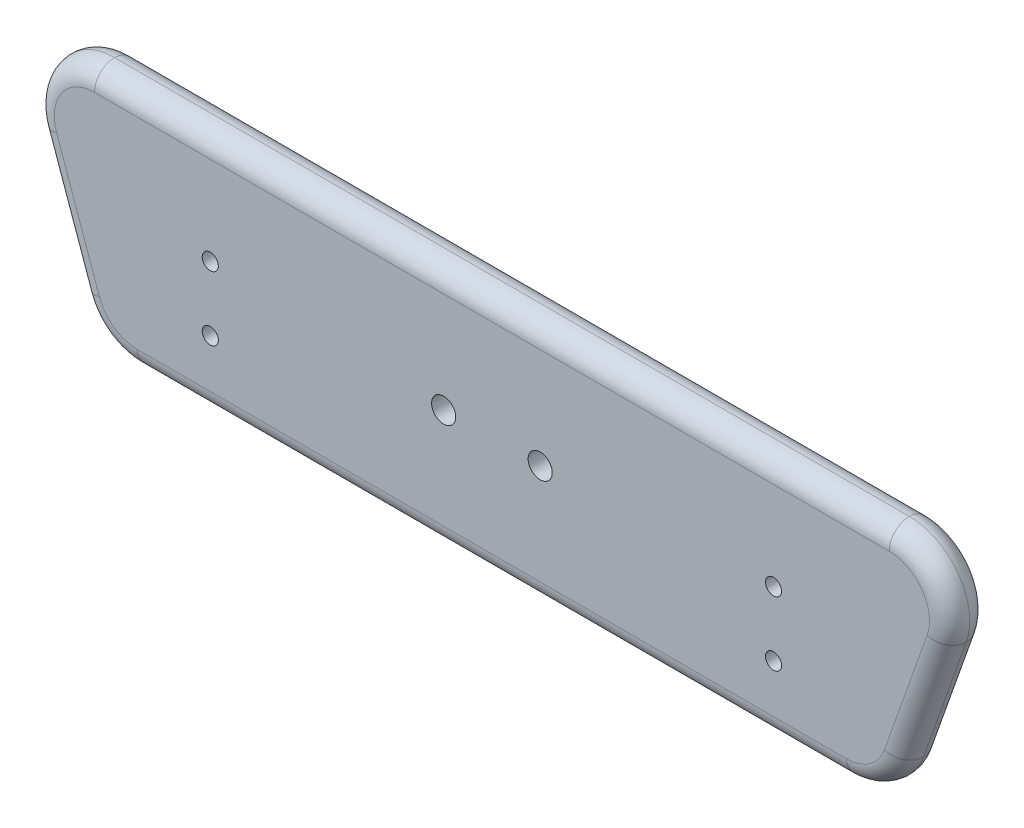
from build123d import *

# Parameters (mm, degrees)
EXTRUDE_1_DEPTH     = 10
FILLET_1_R          = 15
FILLET_2_R          = 5
SKETCH_2_R          = 2
CUT_EXTRUDE_1_DEPTH = 7.5
SKETCH_3_W          = 46
SKETCH_3_H          = 40
CUT_EXTRUDE_2_DEPTH = 4
SKETCH_8_R          = 3
CUT_EXTRUDE_3_DEPTH = 131.716858695


with BuildPart() as part:
    # 草圖1 → 填料-伸長1 (new body)
    with BuildSketch(Plane.XY):
        Polygon((-123.946188341, 3.497757848), (-102.699073989, -56.502242152), (94.806697307, -56.502242152), (116.053811659, 3.497757848), align=None)
    extrude(amount=EXTRUDE_1_DEPTH)

    # 圓角1
    fillet_1_edges = [part.edges().sort_by_distance(p)[0] for p in [
        (116.053811659, 3.497757848, 5),
        (94.806697307, -56.502242152, 5),
        (-102.699073989, -56.502242152, 5),
        (-123.946188341, 3.497757848, 5),
    ]]
    fillet(fillet_1_edges, radius=FILLET_1_R)

    # 圓角2
    fillet_2_edges = [part.edges().sort_by_distance(p)[0] for p in [
        (107.078925905, -2.845064302, 10),
        (103.657146356, -31.509345041, 10),
        (92.862923252, -53.75186548, 10),
        (-3.946188341, -56.502242152, 10),
        (-100.755299934, -53.75186548, 10),
        (-111.549523037, -31.509345041, 10),
        (-114.971302586, -2.845064302, 10),
        (-3.946188341, 3.497757848, 10),
        (-114.971302586, -2.845064302, 0),
        (-111.549523037, -31.509345041, 0),
        (-100.755299934, -53.75186548, 0),
        (-3.946188341, -56.502242152, 0),
        (92.862923252, -53.75186548, 0),
        (103.657146356, -31.509345041, 0),
        (107.078925905, -2.845064302, 0),
        (-3.946188341, 3.497757848, 0),
    ]]
    fillet(fillet_2_edges, radius=FILLET_2_R - 0.0001)  # a hair under: the kernel refuses the full size

    # 草圖2 → 除料-伸長1 (cut)
    with BuildSketch(Plane.XY.offset(10)):
        with Locations((-73.946188341, -23.502242152)):
            Circle(SKETCH_2_R)
        with Locations((-73.946188341, -39.502242152)):
            Circle(SKETCH_2_R)
        with Locations(Location((66.053811659, -39.502242152, 0), (0, 0, 180))):
            Circle(SKETCH_2_R)
        with Locations(Location((66.053811659, -23.502242152, 0), (0, 0, 180))):
            Circle(SKETCH_2_R)
    extrude(amount=-CUT_EXTRUDE_1_DEPTH, mode=Mode.SUBTRACT)

    # 草圖3 → 除料-伸長2 (cut)
    with BuildSketch(Plane(origin=(0, 0, 0), x_dir=(-1, 0, 0), z_dir=(0, 0, -1))):
        with Locations((3.946188341, -26.502242152)):
            Rectangle(SKETCH_3_W, SKETCH_3_H)
    extrude(amount=-CUT_EXTRUDE_2_DEPTH, mode=Mode.SUBTRACT)

    # 草圖8 → 除料-伸長3 (cut, through all)
    with BuildSketch(Plane(origin=(0, 0, 4), x_dir=(-1, 0, 0), z_dir=(0, 0, -1))):
        with Locations((15.946188341, -26.502242152)):
            Circle(SKETCH_8_R)
        with Locations(Location((-8.053811659, -26.502242152, 0), (0, 0, 180))):
            Circle(SKETCH_8_R)
    extrude(amount=-CUT_EXTRUDE_3_DEPTH, mode=Mode.SUBTRACT)


solid = part.part
